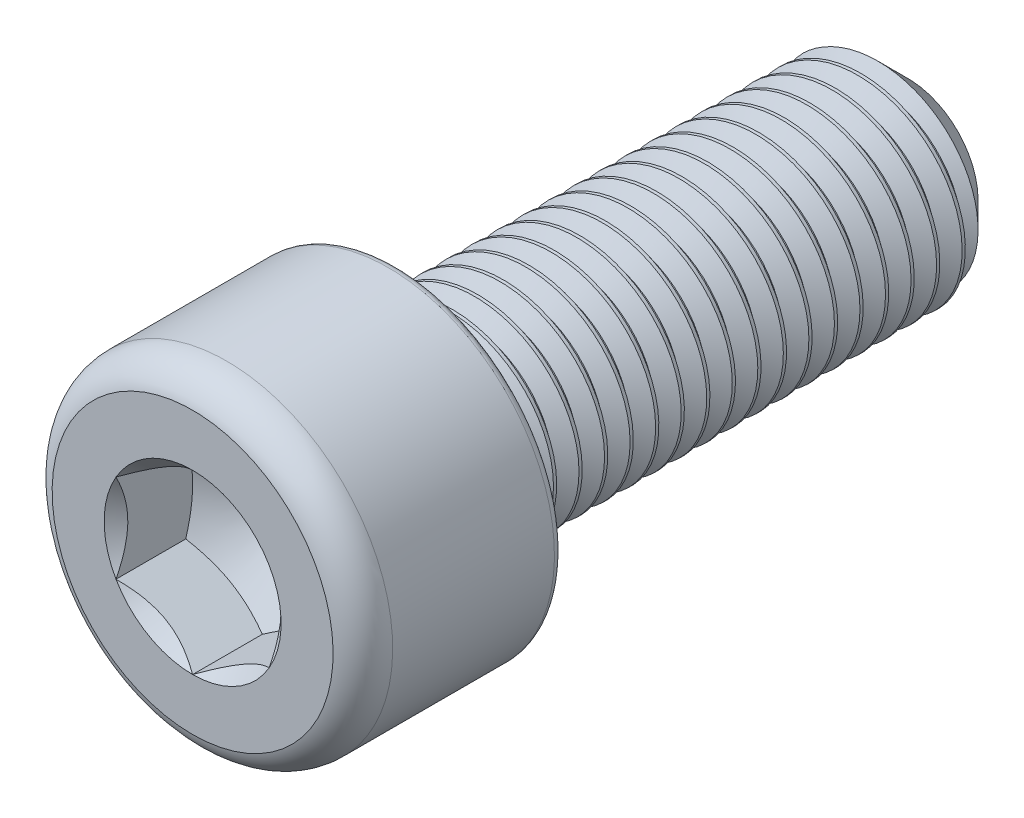
from build123d import *

# Parameters (mm, degrees)
FILLET2_R          = 0.333333333
CUT_EXTRUDE1_REACH = 31.47
CUT_SWEEP1_PITCH   = 1
CUT_SWEEP1_TO      = 20


with BuildPart() as part:
    # Sketch2 → Revolve1 (revolve)
    with BuildSketch(Plane(origin=(0, 0, 0), x_dir=(0, 0, -1), z_dir=(1, 0, 0)), mode=Mode.PRIVATE) as revolve1_sk:
        with BuildLine():
            Line((-8, 5.5), (-8, 3))
            Line((-8, 3), (-5, 3))
            Line((-5, 3), (-3.267949192, 0))
            Line((-3.267949192, 0), (20, 0))
            Line((20, 0), (20, 2.75))
            Line((20, 2.75), (18.75, 4))
            Line((18.75, 4), (0, 4))
            Line((0, 4), (0, 6.5))
            Line((0, 6.5), (-6.666666667, 6.5))
            ThreePointArc((-6.666666667, 6.5), (-7.5, 6.222222222), (-8, 5.5))
        make_face()
    revolve(revolve1_sk.sketch.rotate(Axis((0, 0, 3.267949192), (0, 0, -1)), 180), axis=Axis((0, 0, 3.267949192), (0, 0, -1)))

    # Fillet2
    fillet2_edges = [part.edges().sort_by_distance(p)[0] for p in [
        (0, 6.5, 0),
    ]]
    fillet(fillet2_edges, radius=FILLET2_R)

    # Cut-Extrude1: up to this cone (the profile starts inside it)
    cut_extrude1_end = Plane(origin=(0, 0, 8), z_dir=(0, 0, 1)).offset(-4.732049808) * Cone(1.732e-06, 77.765969163, 44.89820223, align=(Align.CENTER, Align.CENTER, Align.MIN), mode=Mode.PRIVATE)
    # Sketch3 → Cut-Extrude1 (cut, up to the surface)
    with BuildSketch(Plane.XY.offset(8), mode=Mode.PRIVATE) as cut_extrude1_sk1:
        Polygon((0, 3.464101615), (-3, 1.732050808), (-3, -1.732050808), (0, -3.464101615), (3, -1.732050808), (3, 1.732050808), align=None)
    cut_extrude1_tool1 = extrude(cut_extrude1_sk1.sketch, amount=-CUT_EXTRUDE1_REACH, mode=Mode.PRIVATE) & cut_extrude1_end
    add(cut_extrude1_tool1.solids().sort_by_distance((0, 0, 8))[0], mode=Mode.SUBTRACT)

    # Cut-Extrude2 cone 1 section (through the dimple's axis) → Cut-Extrude2 (revolve, cut)
    with BuildSketch(Plane(origin=(0, 0, 8), x_dir=(0, -1, 0), z_dir=(1, 0, 0))):
        Polygon((0, 0), (3.464101615, 0), (0, 3.464101615), align=None)
    revolve(axis=Axis((0, 0, 8), (0, 0, -1)), mode=Mode.SUBTRACT)


with BuildPart() as body_2:
    # Split1: read off the stored shape, not the designer's step
    # Split1: the piece on the far side of the plane
    add(part.part)
    split(bisect_by=Plane.XY, keep=Keep.BOTTOM)

    # Cut-Sweep1: arcs per turn and ends read off the stored shape
    # Cut-Sweep1: the profile of Sketch6 screwed along a right-hand helix through 21 turns, 8 arcs to a turn; built about Z, then put on its axis
    cut_sweep1_z = Axis((0, 0, 0), (0, 0, 1))
    cut_sweep1_corners = [(3.350480947, 0, -0.375), (3.350480947, 0, -0.5), (4.054126588, 0, -0.90625), (4.054126588, 0, 0.03125)]
    with BuildLine(mode=Mode.PRIVATE) as cut_sweep1_profile:
        Line(cut_sweep1_corners[0], cut_sweep1_corners[1])
        Line(cut_sweep1_corners[1], cut_sweep1_corners[2])
        Line(cut_sweep1_corners[2], cut_sweep1_corners[3])
        Line(cut_sweep1_corners[3], cut_sweep1_corners[0])
    cut_sweep1_cap = Face(cut_sweep1_profile.wire())
    cut_sweep1_turn_angles = [0, 22.5, 45, 67.5, 90, 112.5, 135, 157.5, 180, 202.5, 225, 247.5, 270, 292.5, 315, 337.5, 360]
    cut_sweep1_turn_weights = [1, 0.9238795325112867, 1, 0.9238795325112867, 1, 0.9238795325112867, 1, 0.9238795325112867, 1, 0.9238795325112867, 1, 0.9238795325112867, 1, 0.9238795325112867, 1, 0.9238795325112867, 1]
    cut_sweep1_turn_rails = [Edge.make_bspline([Vector(p[0], p[1], 0).rotate(cut_sweep1_z, cut_sweep1_turn_angles[k]) / cut_sweep1_turn_weights[k] + Vector(0, 0, p[2] + CUT_SWEEP1_PITCH * cut_sweep1_turn_angles[k] / 360) for k in range(17)], [0, 0, 0, 1, 1, 2, 2, 3, 3, 4, 4, 5, 5, 6, 6, 7, 7, 8, 8, 8], 2, cut_sweep1_turn_weights) for p in cut_sweep1_corners]
    cut_sweep1_turn_sides = [Face.make_surface_from_curves(cut_sweep1_turn_rails[p[0]], cut_sweep1_turn_rails[p[1]]) for p in [(0, 1), (1, 2), (2, 3), (3, 0)]]
    cut_sweep1 = Plane(origin=(0, 0, -20), x_dir=(0, 1, 0), z_dir=(0, 0, 1)) * split(Solid(Shell([*[p.moved(Location((0, 0, CUT_SWEEP1_PITCH * i))) for i in range(21) for p in cut_sweep1_turn_sides], cut_sweep1_cap, cut_sweep1_cap.rotate(cut_sweep1_z, 7560).moved(Location((0, 0, CUT_SWEEP1_PITCH * 7560 / 360)))])), bisect_by=Plane.XY.offset(CUT_SWEEP1_TO), keep=Keep.BOTTOM, mode=Mode.PRIVATE)
    add(cut_sweep1, mode=Mode.SUBTRACT)


with BuildPart() as part_1:
    add(part.part)

    # Split1
    split(bisect_by=Plane.XY, keep=Keep.TOP)

    add(body_2.part)  # Boss-Extrude1 merges body 2
    # Boss-Extrude1 cone 1 section (through the dimple's axis) → Boss-Extrude1 (revolve)
    with BuildSketch(Plane(origin=(0, 0, 0), x_dir=(0, -1, 0), z_dir=(1, 0, 0))):
        Polygon((0, 0), (4, 0), (0, 4), align=None)
    revolve(axis=Axis((0, 0, 0), (0, 0, -1)))


solid = part_1.part
